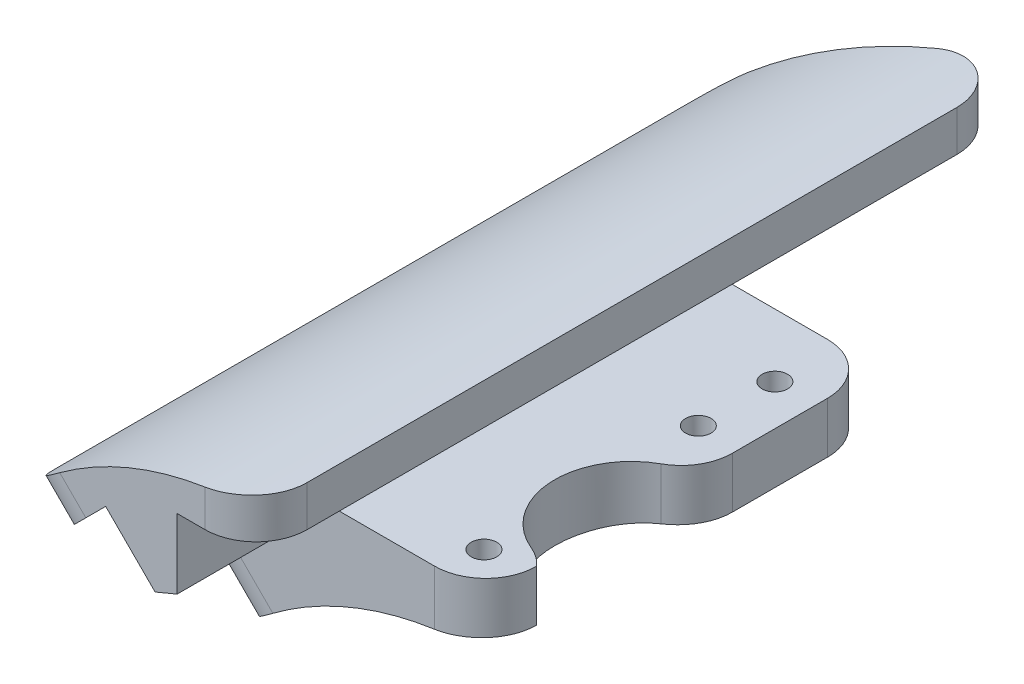
from build123d import *

# Parameters (mm, degrees)
BOSS_EXTRUDE1_DEPTH     = 170
CUT_EXTRUDE1_DEPTH      = 361.516324937
CUT_EXTRUDE1_DEPTH_BACK = 361.516324937
SKETCH11_W              = 61.013930931
SKETCH11_H              = 50
SKETCH11_H_2            = 30
CUT_EXTRUDE10_DEPTH     = 20.91064
FILLET1_R               = 10
CUT_EXTRUDE6_DEPTH      = 351.484081555
CUT_EXTRUDE6_DEPTH_BACK = 351.484081555
SKETCH3_R               = 15
CUT_EXTRUDE5_DEPTH      = 281.558073648
CUT_EXTRUDE5_DEPTH_BACK = 281.558073648
SKETCH6_R               = 2.5
CUT_EXTRUDE7_REACH      = 282.558
SKETCH7_R               = 5
CUT_EXTRUDE8_DEPTH      = 351.484081555
CUT_EXTRUDE8_DEPTH_BACK = 351.484081555
SKETCH8_R               = 2.5
CUT_EXTRUDE9_REACH      = 352.484
SKETCH9_R               = 5
FILLET2_R               = 10


with BuildPart() as part:
    # Sketch1 → Boss-Extrude1 (new body)
    with BuildSketch(Plane.XY):
        with BuildLine():
            Line((260.960792308, -3.55505589), (271.920947416, 7.405099218))
            Line((271.920947416, 7.405099218), (281.608310319, -2.282263684))
            Line((281.608310319, -2.282263684), (270.64815521, -13.242418793))
            Line((270.64815521, -13.242418793), (260.041553492, -23.84902051))
            Line((260.041553492, -23.84902051), (267.112621304, -30.920088322))
            ThreePointArc((267.112621304, -30.920088322), (289.730944335, -15.807008047), (316.411075477, -10.5))
            Line((316.411075477, -10.5), (316.411075477, -0.5))
            Line((316.411075477, -0.5), (301.411075477, -0.5))
            Line((301.411075477, -0.5), (285.911075477, -0.5))
            Line((285.911075477, -0.5), (285.911075477, 13.2))
            Line((285.911075477, 13.2), (301.411075477, 13.2))
            Line((301.411075477, 13.2), (301.411075477, 21.2))
            ThreePointArc((301.411075477, 21.2), (276.458072517, 16.236539108), (255.303938058, 2.101798359))
            Line((255.303938058, 2.101798359), (260.960792308, -3.55505589))
        make_face()
    extrude(amount=-BOSS_EXTRUDE1_DEPTH)

    # Sketch2 → Cut-Extrude1 (cut, two sides: drawn at the far end of the back side and taken through both)
    with BuildSketch(Plane(origin=(0, 0, 0), x_dir=(1, 0, 0), z_dir=(0, 1, 0)).offset(-CUT_EXTRUDE1_DEPTH_BACK)):
        Polygon((255.303938058, 135), (255.303938058, 170), (316.411075477, 170), (316.411075477, 157), align=None)
    extrude(amount=CUT_EXTRUDE1_DEPTH + CUT_EXTRUDE1_DEPTH_BACK, mode=Mode.SUBTRACT)

    # Sketch11 → Cut-Extrude10 (cut)
    with BuildSketch(Plane(origin=(50.049639784, -120.830519157, 0), x_dir=(-0.9238795325112852, -0.3826834323650938, 0), z_dir=(0.3826834323650938, -0.9238795325112852, 0))):
        with Locations((-261.627409312, 132)):
            Rectangle(SKETCH11_W, SKETCH11_H)
        with Locations((-261.627409312, 15)):
            Rectangle(SKETCH11_W, SKETCH11_H_2)
    extrude(amount=-CUT_EXTRUDE10_DEPTH, mode=Mode.SUBTRACT)

    # Fillet1
    fillet1_edges = [part.edges().sort_by_distance(p)[0] for p in [
        (258.132365183, -0.726628766, -136.018299979),
        (258.132365183, -0.726628766, 0),
        (301.411075477, 17.2, 0),
        (301.411075477, 17.2, -151.599648847),
        (316.411075477, -5.5, -30),
        (263.577087398, -27.384554416, -30),
        (263.577087398, -27.384554416, -107),
        (316.411075477, -5.5, -107),
    ]]
    fillet(fillet1_edges, radius=FILLET1_R)

    # Sketch3 → Cut-Extrude6 (cut, two sides: drawn at the far end of the back side and taken through both)
    with BuildSketch(Plane(origin=(0, -10.5, 0), x_dir=(0, 0, -1), z_dir=(0, 1, 0)).offset(-CUT_EXTRUDE6_DEPTH_BACK)):
        with Locations((56.438807827, -318.484957124)):
            Circle(SKETCH3_R)
    extrude(amount=CUT_EXTRUDE6_DEPTH + CUT_EXTRUDE6_DEPTH_BACK, mode=Mode.SUBTRACT)

    # Sketch6 → Cut-Extrude5 (cut, two sides: drawn at the far end of the back side and taken through both)
    with BuildSketch(Plane(origin=(149.016354813, -149.016354813, 0), x_dir=(0, 0, 1), z_dir=(0.7071067811865469, -0.7071067811865482, 0)).offset(-CUT_EXTRUDE5_DEPTH_BACK)):
        with Locations(Location((-38.5, -175.013341737, 0), (0, 0, 270))):
            Circle(SKETCH6_R)
        with Locations(Location((-68.5, -175.013341737, 0), (0, 0, 270))):
            Circle(SKETCH6_R)
        with Locations(Location((-98.5, -175.013341737, 0), (0, 0, 270))):
            Circle(SKETCH6_R)
    extrude(amount=CUT_EXTRUDE5_DEPTH + CUT_EXTRUDE5_DEPTH_BACK, mode=Mode.SUBTRACT)

    # Sketch7 → Cut-Extrude7 (cut, up to next)
    with BuildSketch(Plane(origin=(149.016354813, -149.016354813, 0), x_dir=(0, 0, 1), z_dir=(0.7071067811865469, -0.7071067811865482, 0)), mode=Mode.PRIVATE) as cut_extrude7_sk1:
        with Locations(Location((-38.5, -175.013341737, 0), (0, 0, 90))):
            Circle(SKETCH7_R)
    cut_extrude7_tool1 = extrude(cut_extrude7_sk1.sketch, amount=CUT_EXTRUDE7_REACH, mode=Mode.PRIVATE) & part.part
    # Sketch7 → Cut-Extrude7 (cut, up to next)
    with BuildSketch(Plane(origin=(149.016354813, -149.016354813, 0), x_dir=(0, 0, 1), z_dir=(0.7071067811865469, -0.7071067811865482, 0)), mode=Mode.PRIVATE) as cut_extrude7_sk2:
        with Locations(Location((-68.5, -175.013341737, 0), (0, 0, 90))):
            Circle(SKETCH7_R)
    cut_extrude7_tool2 = extrude(cut_extrude7_sk2.sketch, amount=CUT_EXTRUDE7_REACH, mode=Mode.PRIVATE) & part.part
    # Sketch7 → Cut-Extrude7 (cut, up to next)
    with BuildSketch(Plane(origin=(149.016354813, -149.016354813, 0), x_dir=(0, 0, 1), z_dir=(0.7071067811865469, -0.7071067811865482, 0)), mode=Mode.PRIVATE) as cut_extrude7_sk3:
        with Locations(Location((-98.5, -175.013341737, 0), (0, 0, 90))):
            Circle(SKETCH7_R)
    cut_extrude7_tool3 = extrude(cut_extrude7_sk3.sketch, amount=CUT_EXTRUDE7_REACH, mode=Mode.PRIVATE) & part.part
    add(cut_extrude7_tool1.solids().sort_by_distance((272.769476, -25.263234, -38.5))[0], mode=Mode.SUBTRACT)
    add(cut_extrude7_tool2.solids().sort_by_distance((272.769476, -25.263234, -68.5))[0], mode=Mode.SUBTRACT)
    add(cut_extrude7_tool3.solids().sort_by_distance((272.769476, -25.263234, -98.5))[0], mode=Mode.SUBTRACT)

    # Sketch8 → Cut-Extrude8 (cut, two sides: drawn at the far end of the back side and taken through both)
    with BuildSketch(Plane.ZX.offset(-10.5).offset(-CUT_EXTRUDE8_DEPTH_BACK)):
        with Locations((-79.675291454, 308.411075477)):
            Circle(SKETCH8_R)
        with Locations((-94.675291454, 308.411075477)):
            Circle(SKETCH8_R)
        with Locations((-37.662495858, 308.411075477)):
            Circle(SKETCH8_R)
    extrude(amount=CUT_EXTRUDE8_DEPTH + CUT_EXTRUDE8_DEPTH_BACK, mode=Mode.SUBTRACT)

    # Sketch9 → Cut-Extrude9 (cut, up to next)
    with BuildSketch(Plane.ZX.offset(-10.5), mode=Mode.PRIVATE) as cut_extrude9_sk1:
        with Locations((-79.675291454, 308.411075477)):
            Circle(SKETCH9_R)
    cut_extrude9_tool1 = extrude(cut_extrude9_sk1.sketch, amount=-CUT_EXTRUDE9_REACH, mode=Mode.PRIVATE) & part.part
    # Sketch9 → Cut-Extrude9 (cut, up to next)
    with BuildSketch(Plane.ZX.offset(-10.5), mode=Mode.PRIVATE) as cut_extrude9_sk2:
        with Locations((-94.675291454, 308.411075477)):
            Circle(SKETCH9_R)
    cut_extrude9_tool2 = extrude(cut_extrude9_sk2.sketch, amount=-CUT_EXTRUDE9_REACH, mode=Mode.PRIVATE) & part.part
    # Sketch9 → Cut-Extrude9 (cut, up to next)
    with BuildSketch(Plane.ZX.offset(-10.5), mode=Mode.PRIVATE) as cut_extrude9_sk3:
        with Locations((-37.662495858, 308.411075477)):
            Circle(SKETCH9_R)
    cut_extrude9_tool3 = extrude(cut_extrude9_sk3.sketch, amount=-CUT_EXTRUDE9_REACH, mode=Mode.PRIVATE) & part.part
    add(cut_extrude9_tool1.solids().sort_by_distance((308.411075, -10.5, -79.675291))[0], mode=Mode.SUBTRACT)
    add(cut_extrude9_tool2.solids().sort_by_distance((308.411075, -10.5, -94.675291))[0], mode=Mode.SUBTRACT)
    add(cut_extrude9_tool3.solids().sort_by_distance((308.411075, -10.5, -37.662496))[0], mode=Mode.SUBTRACT)

    # Fillet2
    # the kernel refuses this fillet: 10 mm, written as the material it takes off along each edge
    with BuildSketch(Plane(origin=(316.411075477, 8.917395015, -41.582865752), x_dir=(-0.965197010333721, 0, -0.26152386362021934), z_dir=(0, -1, 0))) as fillet2_piece_1:
        with BuildLine():
            CenterArc((5.022610675, -9.920853611), FILLET2_R, 97.213400392, 25.719520286)
            Line((-0.413957167, -1.527777292), (-0.522688524, -1.359915766))
            ThreePointArc((-0.522688524, -1.359915766), (-0.400017986, -0.711583873), (-0.193039402, 0.052304773))
            Line((-0.193039402, 0.052304773), (0.025113053, 0.198417072))
            ThreePointArc((0.025113053, 0.198417072), (1.883479003, 0.081280417), (3.741844953, 0.198417072))
            Line((3.741844953, 0.198417072), (3.766958006, 0))
        make_face()
    extrude(amount=28.83479063, mode=Mode.SUBTRACT)
    with BuildSketch(Plane(origin=(316.411075477, 17.087958925, -71.294749901), x_dir=(0, 0, -1), z_dir=(0, -1, 0))) as fillet2_piece_2:
        with BuildLine():
            CenterArc((7.03518357, -10), FILLET2_R, 90, 61.121406363)
            Line((-1.721266688, -5.170447341), (-1.896395693, -5.073856288))
            ThreePointArc((-1.896395693, -5.073856288), (-0.813624986, -2.600872978), (-0.198079228, 0.027651755))
            Line((-0.198079228, 0.027651755), (0, 0.2))
            Line((0, 0.2), (7.03518357, 0.2))
            Line((7.03518357, 0.2), (7.03518357, 0))
        make_face()
    extrude(amount=45.175918449, mode=Mode.SUBTRACT)


solid = part.part
